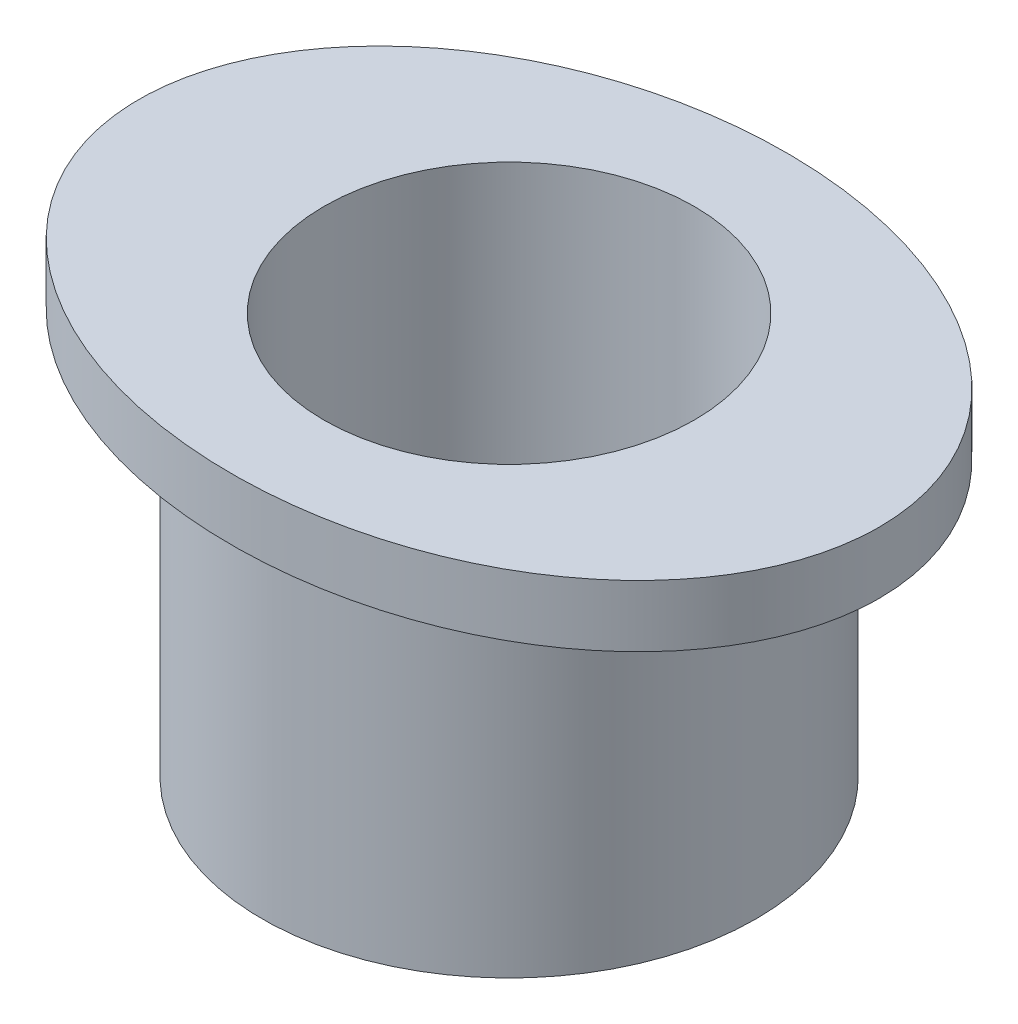
from build123d import *

# Parameters (mm, degrees)
SKETCH1_R           = 4
SKETCH1_R_2         = 3
EXTRUDE_THIN1_DEPTH = 5.5
BOSS_EXTRUDE1_START = 1
SKETCH2_RX          = 6
SKETCH2_RY          = 4.5
SKETCH2_R           = 3
BOSS_EXTRUDE1_DEPTH = 1


with BuildPart() as part:
    # Sketch1 → Extrude-Thin1 (new body)
    with BuildSketch(Plane(origin=(0, 0, 0), x_dir=(1, 0, 0), z_dir=(0, 1, 0))):
        Circle(SKETCH1_R)
        Circle(SKETCH1_R_2, mode=Mode.SUBTRACT)
    extrude(amount=-EXTRUDE_THIN1_DEPTH)

    # Sketch2 → Boss-Extrude1 (add)
    with BuildSketch(Plane(origin=(0, 0, 0), x_dir=(1, 0, 0), z_dir=(0, 1, 0)).offset(BOSS_EXTRUDE1_START)):
        with Locations(Location((0, 0), (0, 0, 0))):
            Ellipse(SKETCH2_RX, SKETCH2_RY)
        Circle(SKETCH2_R, mode=Mode.SUBTRACT)
    extrude(amount=-BOSS_EXTRUDE1_DEPTH)


solid = part.part
